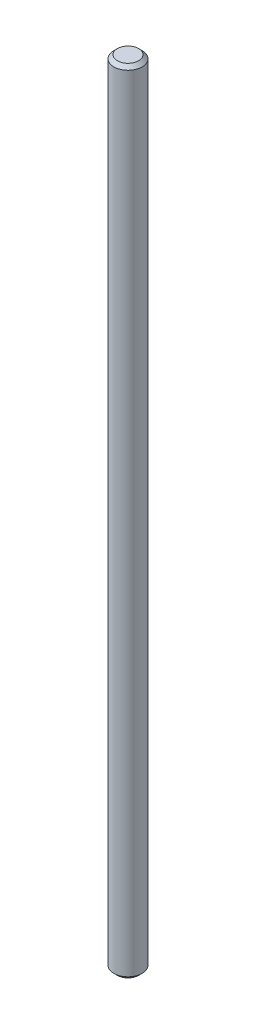
from build123d import *

# Parameters (mm, degrees)
SKETCH1_R           = 4
BOSS_EXTRUDE1_DEPTH = 224
CHAMFER1_SIZE       = 1


with BuildPart() as part:
    # Sketch1 → Boss-Extrude1 (new body)
    with BuildSketch(Plane(origin=(0, 224, 0), x_dir=(1, 0, 0), z_dir=(0, 1, 0))):
        Circle(SKETCH1_R)
    extrude(amount=-BOSS_EXTRUDE1_DEPTH)

    # Chamfer1
    chamfer1_edges = [part.edges().sort_by_distance(p)[0] for p in [
        (-4, 0, 0),
        (-4, 224, 0),
    ]]
    chamfer(chamfer1_edges, length=CHAMFER1_SIZE)


solid = part.part
